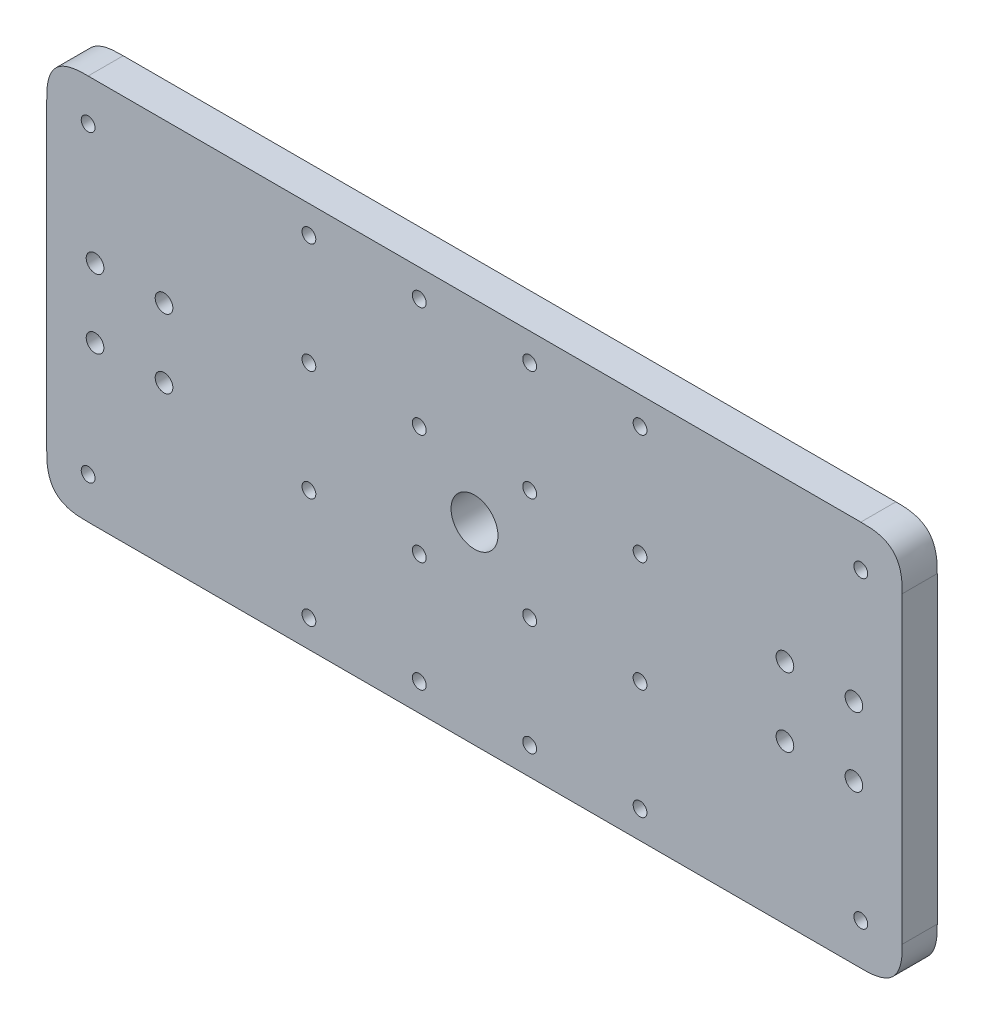
from build123d import *

# Parameters (mm, degrees)
SKETCH1_W                           = 310
SKETCH1_H                           = 140
BOSS_EXTRUDE1_DEPTH                 = 12.7
TAP_DRILL_FOR_M6X1_0_TAP1_D         = 5
LPATTERN1_COUNT                     = 4
LPATTERN1_PITCH                     = 40
LPATTERN1_COUNT_DIR2                = 4
LPATTERN1_PITCH_DIR2                = 40
FILLET1_SIZE                        = 15
M6_CLEARANCE_HOLE1_D                = 6.4
M16_CLEARANCE_HOLE1_D               = 17
TAP_START                           = -1
TAP_DRILL_FOR_M6X1_0_TAP2_OUTLINE_R = 2.5
TAP_DRILL_FOR_M6X1_0_TAP2_DEPTH     = 15


with BuildPart() as part:
    # Sketch1 → Boss-Extrude1 (new body)
    with BuildSketch(Plane.XY):
        Rectangle(SKETCH1_W, SKETCH1_H)
    extrude(amount=BOSS_EXTRUDE1_DEPTH)

    # Tap Drill for M6x1.0 Tap1 (through all)
    with Locations(Plane.XY.offset(12.7)):
        with Locations((-60, 60)):
            tap_drill_for_m6x1_0_tap1 = Hole(TAP_DRILL_FOR_M6X1_0_TAP1_D / 2)

    # LPattern1: Tap Drill for M6x1.0 Tap1 4 × 4
    with Locations(*[(i * LPATTERN1_PITCH, -j * LPATTERN1_PITCH_DIR2, 0) for i in range(LPATTERN1_COUNT) for j in range(LPATTERN1_COUNT_DIR2) if (i, j) != (0, 0)]):
        add(tap_drill_for_m6x1_0_tap1, mode=Mode.SUBTRACT)

    # Fillet1
    # a fillet whose section is not a circle: 15 mm, written as the material it takes off along each edge
    with BuildSketch(Plane(origin=(155, -70, -37.5), x_dir=(0, 1, 0), z_dir=(0, 0, 1)), Plane(origin=(155, 70, -37.5), x_dir=(-1, 0, 0), z_dir=(0, 0, 1))) as fillet1_piece_1:
        with BuildLine():
            add(Edge.make_bspline([(FILLET1_SIZE, 0), (FILLET1_SIZE * 0.831801948466, 0), (FILLET1_SIZE * 0.663603896932, 0), (FILLET1_SIZE * 0.292893218813, FILLET1_SIZE * 0.0716919198361), (FILLET1_SIZE * 0.0716919198361, FILLET1_SIZE * 0.292893218813), (0, FILLET1_SIZE * 0.663603896932), (0, FILLET1_SIZE * 0.831801948466), (0, FILLET1_SIZE)], knots=[0, 0, 0, 0, 0, 0, 0.5, 0.5, 1, 1, 1, 1, 1, 1], degree=5))
            Line((0, FILLET1_SIZE), (0, 0))
            Line((0, 0), (FILLET1_SIZE, 0))
        make_face()
    extrude(amount=87.7, mode=Mode.SUBTRACT)
    with BuildSketch(Plane(origin=(-155, 70, -37.5), x_dir=(1, 0, 0), z_dir=(0, 0, 1)), Plane(origin=(-155, -70, -37.5), x_dir=(0, 1, 0), z_dir=(0, 0, 1))) as fillet1_piece_2:
        with BuildLine():
            add(Edge.make_bspline([(FILLET1_SIZE, 0), (FILLET1_SIZE * 0.831801948466, 0), (FILLET1_SIZE * 0.663603896932, 0), (FILLET1_SIZE * 0.292893218813, -FILLET1_SIZE * 0.0716919198361), (FILLET1_SIZE * 0.0716919198361, -FILLET1_SIZE * 0.292893218813), (0, -FILLET1_SIZE * 0.663603896932), (0, -FILLET1_SIZE * 0.831801948466), (0, -FILLET1_SIZE)], knots=[0, 0, 0, 0, 0, 0, 0.5, 0.5, 1, 1, 1, 1, 1, 1], degree=5))
            Line((0, -FILLET1_SIZE), (0, 0))
            Line((0, 0), (FILLET1_SIZE, 0))
        make_face()
    extrude(amount=87.7, mode=Mode.SUBTRACT)

    # M6 Clearance Hole1 (through all)
    with Locations(Plane(origin=(0, 0, 0), x_dir=(-1, 0, 0), z_dir=(0, 0, -1))):
        with Locations((137.5, -12.5), (137.5, 12.5), (112.5, 12.5), (112.5, -12.5), (-112.5, -12.5), (-137.5, -12.5), (-112.5, 12.5), (-137.5, 12.5)):
            Hole(M6_CLEARANCE_HOLE1_D / 2)

    # M16 Clearance Hole1 (through all)
    with Locations(Plane.XY.offset(12.7)):
        with Locations((0, 0)):
            Hole(M16_CLEARANCE_HOLE1_D / 2)

    # Tap Drill for M6x1.0 Tap2: read off the stored shape, not the designer's step
    # Tap Drill for M6x1.0 Tap2 outline → Tap Drill for M6x1.0 Tap2 (cut)
    with BuildSketch(Plane.XY.offset(TAP_START)):
        with Locations((140, 55)):
            Circle(TAP_DRILL_FOR_M6X1_0_TAP2_OUTLINE_R)
        with Locations((-140, -55)):
            Circle(TAP_DRILL_FOR_M6X1_0_TAP2_OUTLINE_R)
        with Locations((140, -55)):
            Circle(TAP_DRILL_FOR_M6X1_0_TAP2_OUTLINE_R)
        with Locations((-140, 55)):
            Circle(TAP_DRILL_FOR_M6X1_0_TAP2_OUTLINE_R)
    extrude(amount=TAP_DRILL_FOR_M6X1_0_TAP2_DEPTH, mode=Mode.SUBTRACT)


solid = part.part
